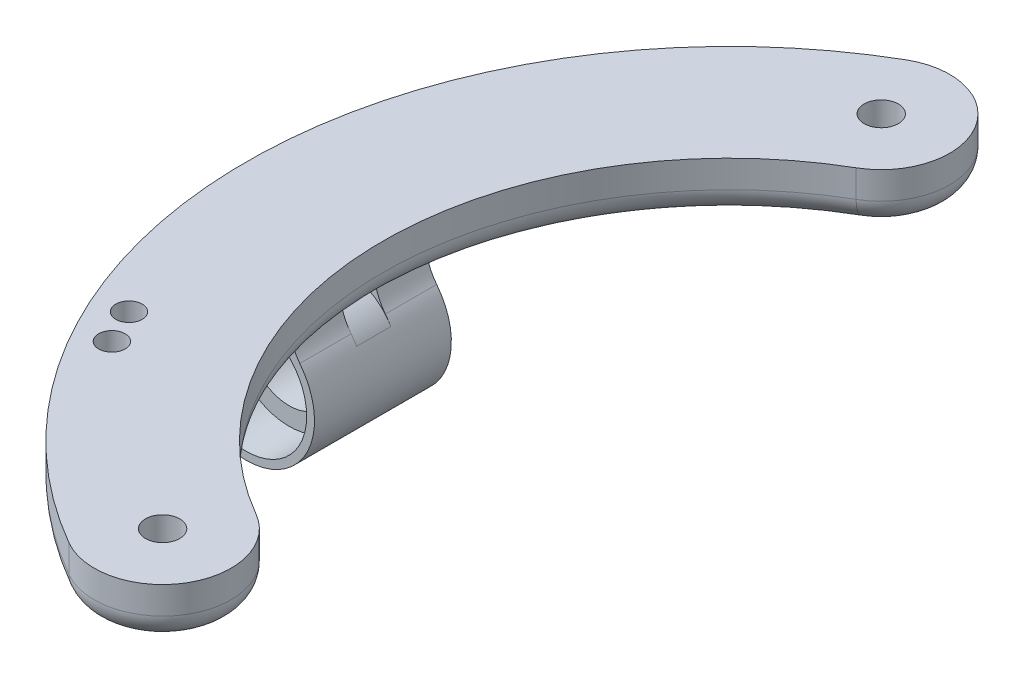
from build123d import *

# Parameters (mm, degrees)
SENSORARMATURE_DEPTH                  = 12.7
SENSORARMATURE_DEPTH_BACK             = 12.7
SKETCH2_R                             = 7.9375
SKETCH2_R_2                           = 4
SKETCH2_R_3                           = 2.38125
SKETCH15_R                            = 11.25
BEARINGRACE1_DEPTH                    = 8
SKETCH16_R                            = 11.25
BEARINGRACE2_DEPTH                    = 8
CUT_EXTRUDE3_DEPTH                    = 188.895496905
FILLET1_R                             = 9.525
MAINSENSORINSET_DEPTH                 = 6.35
F_10_0_1935_DIAMETER_HOLE1_D          = 4.9149
F_1_4_0_25_DIAMETER_HOLE1_D           = 6.35
F_1_4_0_25_DIAMETER_HOLE1_CSINK_D     = 7.62
F_1_4_0_25_DIAMETER_HOLE1_CSINK_ANGLE = 90
CUT_EXTRUDE6_DEPTH                    = 132.65094541
CUT_EXTRUDE6_DEPTH_BACK               = 132.65094541
FILLET2_ANGLE                         = 180
FILLET2_2_ANGLE                       = 180


with BuildPart() as part:
    # Sketch1 → MainAttachmentRing (revolve)
    with BuildSketch(Plane.XY, mode=Mode.PRIVATE) as mainattachmentring_sk:
        with BuildLine():
            Line((-64.29375, 0), (-64.29375, -5.08))
            ThreePointArc((-64.29375, -5.08), (-65.688653955, -8.447596045), (-69.05625, -9.8425))
            Line((-69.05625, -9.8425), (-84.93125, -9.8425))
            ThreePointArc((-84.93125, -9.8425), (-88.298846045, -8.447596045), (-89.69375, -5.08))
            Line((-89.69375, -5.08), (-89.69375, 0))
            Line((-89.69375, 0), (-64.29375, 0))
        make_face()
    revolve(mainattachmentring_sk.sketch.rotate(Axis((0, -6.614583333, 0), (0, 1, 0)), 270), axis=Axis((0, -6.614583333, 0), (0, 1, 0)))

    # Sketch2 → SensorArmature (add, two sides: drawn at the far end of the back side and taken through both)
    # profile 1 of 2: a face of its own
    with BuildSketch(Plane.XY.offset(-SENSORARMATURE_DEPTH_BACK)):
        with BuildLine():
            Line((-69.05625, -8.794346715), (-69.05625, -3.4925))
            Line((-69.05625, -3.4925), (-84.93125, -3.4925))
            Line((-84.93125, -3.4925), (-84.93125, -8.794346715))
            ThreePointArc((-84.93125, -8.794346715), (-85.455970986, -11.912134822), (-86.972321429, -14.686412409))
            ThreePointArc((-86.972321429, -14.686412409), (-76.99375, -35.2425), (-67.015178571, -14.686412409))
            ThreePointArc((-67.015178571, -14.686412409), (-68.531529014, -11.912134822), (-69.05625, -8.794346715))
        make_face()
        with Locations((-76.99375, -22.5425)):
            Circle(SKETCH2_R, mode=Mode.SUBTRACT)
    # profile 2 of 2: a face of its own
    with BuildSketch(Plane.XY.offset(-SENSORARMATURE_DEPTH_BACK)):
        with Locations((-76.99375, -22.5425)):
            Circle(SKETCH2_R_2)
        with Locations((-76.99375, -22.5425)):
            Circle(SKETCH2_R_3, mode=Mode.SUBTRACT)
    extrude(amount=SENSORARMATURE_DEPTH + SENSORARMATURE_DEPTH_BACK)


with BuildPart() as sensorarmature_kept_piece:
    # of the separate pieces the step leaves, the one the design keeps (sensorarmature_pieces_kept)
    add(part.part.solids().sort_by_distance((0, 0, -64.29375))[0])

    # Sketch15 → BearingRace1 (cut)
    with BuildSketch(Plane.XY.offset(12.7)):
        with Locations((-76.99375, -22.5425)):
            Circle(SKETCH15_R)
    extrude(amount=-BEARINGRACE1_DEPTH, mode=Mode.SUBTRACT)

    # Sketch16 → BearingRace2 (cut)
    with BuildSketch(Plane(origin=(0, 0, -12.7), x_dir=(-1, 0, 0), z_dir=(0, 0, -1))):
        with Locations(Location((76.99375, -22.5425, 0), (0, 0, 180))):
            Circle(SKETCH16_R)
    extrude(amount=-BEARINGRACE2_DEPTH, mode=Mode.SUBTRACT)

    # Sketch17 → Cut-Extrude3 (cut, through all)
    with BuildSketch(Plane(origin=(65.0875, 22.225, 0), x_dir=(0, 0, 1), z_dir=(-1, 0, 0))):
        with BuildLine():
            Line((2.825941823, -32.0675), (3.175, -32.0675))
            Line((3.175, -32.0675), (3.175, -33.655))
            Line((3.175, -33.655), (-3.175, -33.655))
            Line((-3.175, -33.655), (-3.175, -32.0675))
            Line((-3.175, -32.0675), (-2.825941823, -32.0675))
            add(Edge.make_bspline(
                [(-2.825941823, -32.0675), (-0.941980608, -32.0675), (0.941980608, -32.0675), (2.825941823, -32.0675)],
                knots=[0, 0, 0, 0, 1, 1, 1, 1], degree=3))
        make_face()
    extrude(amount=CUT_EXTRUDE3_DEPTH, mode=Mode.SUBTRACT)

    # Fillet1
    # the kernel refuses this fillet: 9.525 mm, written as the material it takes off along each edge
    with BuildSketch(Plane(origin=(-68.684334549, -11.43, 3.175), x_dir=(-1, 0, 0), z_dir=(0, 0, -1))) as fillet1_piece_1:
        with BuildLine():
            CenterArc((5.559784794, -9.525), FILLET1_R, 90, 60)
            Line((-2.689107177, -4.7625), (-3.513996374, -4.28625))
            ThreePointArc((-3.513996374, -4.28625), (-2.417548835, -2.667205839), (-0.915308455, 0.263565329))
            Line((-0.915308455, 0.263565329), (0, 0.9525))
            Line((0, 0.9525), (5.559784794, 0.9525))
            Line((5.559784794, 0.9525), (5.559784794, 0))
        make_face()
    extrude(amount=6.35, mode=Mode.SUBTRACT)
    with BuildSketch(Plane(origin=(-85.303165451, -11.43, 3.175), x_dir=(1, 0, 0), z_dir=(0, 0, -1))) as fillet1_piece_2:
        with BuildLine():
            CenterArc((5.559784794, 9.525), FILLET1_R, 210, 60)
            Line((-2.689107177, 4.7625), (-3.513996374, 4.28625))
            ThreePointArc((-3.513996374, 4.28625), (-2.417548835, 2.667205839), (-0.915308455, -0.263565329))
            Line((-0.915308455, -0.263565329), (0, -0.9525))
            Line((0, -0.9525), (5.559784794, -0.9525))
            Line((5.559784794, -0.9525), (5.559784794, 0))
        make_face()
    extrude(amount=6.35, mode=Mode.SUBTRACT)

    # Sketch19 → MainSensorInset (cut)
    with BuildSketch(Plane.XZ.offset(9.8425)):
        with BuildLine():
            Line((-83.97634921, 15.875), (-68.998403727, 15.875))
            Line((-68.998403727, 15.875), (-68.998403727, 23.64608578))
            ThreePointArc((-68.998403727, 23.64608578), (-68.895293758, 24.785763339), (-68.589312408, 25.888429207))
            ThreePointArc((-68.589312408, 25.888429207), (-65.62931995, 32.672571163), (-62.000346171, 39.123670816))
            ThreePointArc((-62.000346171, 39.123670816), (-62.991085358, 43.50313264), (-67.370547181, 42.512393453))
            ThreePointArc((-67.370547181, 42.512393453), (-70.269181894, 37.52780703), (-72.79966532, 32.346606528))
            ThreePointArc((-72.79966532, 32.346606528), (-75.142159242, 29.600748947), (-78.602628968, 28.575))
            Line((-78.602628968, 28.575), (-83.97634921, 28.575))
            Line((-83.97634921, 28.575), (-83.97634921, 15.875))
        make_face()
    extrude(amount=-MAINSENSORINSET_DEPTH, mode=Mode.SUBTRACT)

    # #10 (0.1935) Diameter Hole1 (through all)
    with Locations(Plane(origin=(0, -9.8425, 0), x_dir=(-1, 0, 0), z_dir=(0, -1, 0))):
        with Locations((73.312376468, -41.275), (76.487376468, -34.925)):
            Hole(F_10_0_1935_DIAMETER_HOLE1_D / 2)

    # 1/4 (0.25) Diameter Hole1 (through all)
    with Locations(Plane(origin=(0, -9.8425, 0), x_dir=(-1, 0, 0), z_dir=(0, -1, 0))):
        with Locations((-76.99375, 0), (38.496875, 66.678543433), (38.496875, -66.678543433), (0, 0)):
            CounterSinkHole(F_1_4_0_25_DIAMETER_HOLE1_D / 2, F_1_4_0_25_DIAMETER_HOLE1_CSINK_D / 2, counter_sink_angle=F_1_4_0_25_DIAMETER_HOLE1_CSINK_ANGLE)

    # Sketch28 → Cut-Extrude6 (cut, two sides: drawn at the far end of the back side and taken through both)
    with BuildSketch(Plane(origin=(0, 0, 0), x_dir=(1, 0, 0), z_dir=(0, 1, 0)).offset(-CUT_EXTRUDE6_DEPTH_BACK)):
        with BuildLine():
            Line((0, 0), (-32.146875, 55.680020805))
            ThreePointArc((-32.146875, 55.680020805), (-27.498352372, 73.028543433), (-44.846875, 77.677066061))
            Line((-44.846875, 77.677066061), (-52.641298624, 91.177403793))
            Line((-52.641298624, 91.177403793), (62.971207783, 117.188002958))
            Line((62.971207783, 117.188002958), (148.903396654, 11.630273141))
            Line((148.903396654, 11.630273141), (-6.989072656, -155.463930645))
            Line((-6.989072656, -155.463930645), (-55.413884825, -95.979663962))
            Line((-55.413884825, -95.979663962), (-44.846875, -77.677066061))
            ThreePointArc((-44.846875, -77.677066061), (-27.498352372, -73.028543433), (-32.146875, -55.680020805))
            Line((-32.146875, -55.680020805), (0, 0))
        make_face()
    extrude(amount=CUT_EXTRUDE6_DEPTH + CUT_EXTRUDE6_DEPTH_BACK, mode=Mode.SUBTRACT)

    # Fillet2: read off the stored shape, not the designer's step
    # Fillet2 outline → Fillet2 (revolve, cut)
    with BuildSketch(Plane(origin=(-38.496875, 0, 66.678543433), x_dir=(-0.4999999999999933, 0, 0.8660254037844425), z_dir=(-0.8660254037844425, 0, -0.4999999999999933))):
        with BuildLine():
            ThreePointArc((12.7, -5.08), (11.305096045, -8.447596045), (7.9375, -9.8425))
            Line((7.9375, -9.8425), (12.7, -9.8425))
            Line((12.7, -9.8425), (12.7, -5.08))
        make_face()
    revolve(axis=Axis((-38.496875, 0, 66.678543433), (0, 1, 0)), revolution_arc=FILLET2_ANGLE, mode=Mode.SUBTRACT)

    # Fillet2 2 outline → Fillet2 2 (revolve, cut)
    with BuildSketch(Plane(origin=(-38.496875, 0, -66.678543433), x_dir=(0.4999999999999988, 0, 0.8660254037844394), z_dir=(-0.8660254037844394, 0, 0.4999999999999988))):
        with BuildLine():
            ThreePointArc((12.7, -5.08), (11.305096045, -8.447596045), (7.9375, -9.8425))
            Line((7.9375, -9.8425), (12.7, -9.8425))
            Line((12.7, -9.8425), (12.7, -5.08))
        make_face()
    revolve(axis=Axis((-38.496875, 0, -66.678543433), (0, 1, 0)), revolution_arc=FILLET2_2_ANGLE, mode=Mode.SUBTRACT)


solid = sensorarmature_kept_piece.part
